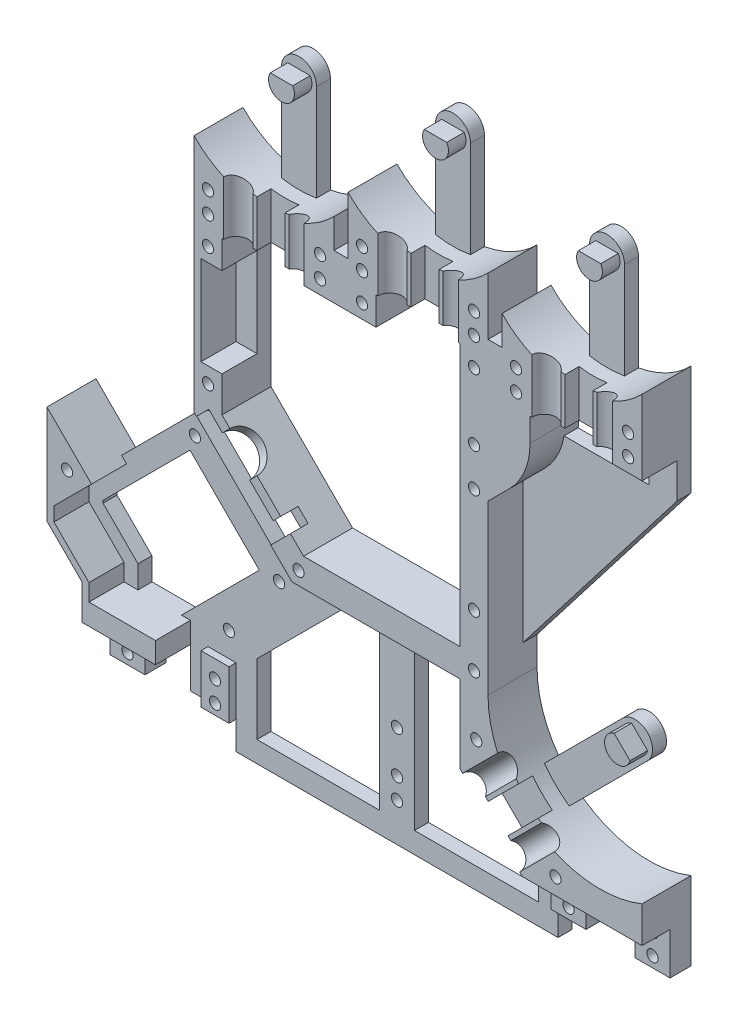
from build123d import *

# Parameters (mm, degrees)
SKETCH1_W                    = 12
SKETCH1_H                    = 5
BOSS_EXTRUDE1_DEPTH          = 2
BOSS_EXTRUDE2_DEPTH          = 7
BOSS_EXTRUDE3_DEPTH          = 2
BOSS_EXTRUDE4_START          = 2
BOSS_EXTRUDE4_DEPTH          = 2.5
WIRE_START                   = 67.5
WIRE_AND_TUBE_CANALS_DEPTH   = 13
CUT_EXTRUDE3_START           = 3
SKETCH42_W                   = 5
SKETCH42_H                   = 6
SKETCH42_W_2                 = 6.5
SKETCH42_H_2                 = 7
SKETCH42_W_3                 = 6
SKETCH42_H_3                 = 6.000000003
CUT_EXTRUDE3_DEPTH           = 4
FILLET1_R                    = 10
POT_INSERT1_DEPTH            = 2.5
POT_START                    = -2.5
SKETCH36_R                   = 2.75
POT_HOLE_DEPTH               = 1.5
POT_INSERT2_DEPTH            = 2.5
SKETCH3_R                    = 0.800000001
SKETCH3_R_2                  = 0.8
MECHANICAL_SCREW_HOLES_DEPTH = 128.295915171
SKETCH44_R                   = 0.8
ELECTRICAL_SCREW_HOLES_DEPTH = 128.295915171
CUT_EXTRUDE4_DEPTH           = 10


with BuildPart() as part:
    # Sketch1 → Boss-Extrude1 (new body)
    with BuildSketch(Plane.XY):
        with BuildLine():
            Line((68, 10.000000001), (85, 10.000000001))
            Line((85, 10.000000001), (85, 15.167603024))
            ThreePointArc((85, 15.167603024), (70.05572809, 16.73350084), (63, 30.000000001))
            Line((63, 30.000000001), (63, 34.000000004))
            Line((63, 34.000000004), (85, 62.500000004))
            Line((85, 62.500000004), (85, 71.500000004))
            Line((85, 71.500000004), (63, 71.500000004))
            Line((63, 71.500000004), (63, 75.500000004))
            Line((63, 75.500000004), (43, 75.500000004))
            Line((43, 75.500000004), (43, 71.500000004))
            Line((43, 71.500000004), (21, 71.500000004))
            Line((21, 71.500000004), (21, 43.999896972))
            Line((21, 43.999896972), (33.106562233, 31.893334739))
            Line((33.106562233, 31.893334739), (28.156814765, 26.943587271))
            Line((28.156814765, 26.943587271), (16.135999485, 38.964402551))
            Line((16.135999485, 38.964402551), (5.656854249, 28.485257316))
            Line((5.656854249, 28.485257316), (0, 34.142111565))
            Line((0, 34.142111565), (0, 20))
            Line((0, 20), (5, 15))
            Line((5, 15), (5, 10))
            Line((5, 10), (22, 10))
            Line((22, 10), (22, 0))
            Line((22, 0), (68, 0))
            Line((68, 0), (68, 10))
        make_face()
        Polygon((42.5, 3), (25, 3), (25, 13), (42.000000003, 30.000000003), (42.5, 30.000000003), align=None, mode=Mode.SUBTRACT)
        Polygon((3, 21.585762379), (15.428892704, 34.014655083), (25.328490668, 24.115057118), (14.21343355, 13), (8, 13), (8, 16.242640687), (3, 21.242640687), align=None, mode=Mode.SUBTRACT)
        Polygon((59.000000001, 18.887301629), (65.211417768, 12.675883862), (65.211417768, 2.999999998), (47.500000002, 2.999999998), (47.500000002, 30.000000001), (59.000000001, 30.000000001), align=None, mode=Mode.SUBTRACT)
        Polygon((25.000000003, 67.500000001), (47.000000003, 67.500000001), (47.000000003, 71.500000004), (59.000000003, 71.500000004), (59.000000003, 34.000000004), (36.656751217, 34.000000004), (25.000000003, 45.656751219), align=None, mode=Mode.SUBTRACT)
        with Locations((75, 65.000000004)):
            Rectangle(SKETCH1_W, SKETCH1_H, mode=Mode.SUBTRACT)
    extrude(amount=BOSS_EXTRUDE1_DEPTH)

    # Sketch5 → Boss-Extrude2 (add)
    # profile 1 of 2: a face of its own
    with BuildSketch(Plane.XY):
        with BuildLine():
            ThreePointArc((41, 78.202041029), (31, 74), (21, 78.202041029))
            Line((21, 78.202041029), (21, 43.999896972))
            Line((21, 43.999896972), (34.999896969, 30.000000003))
            Line((34.999896969, 30.000000003), (59.000000001, 30.000000003))
            Line((59.000000001, 30.000000003), (59.000000001, 18.887301629))
            Line((59.000000001, 18.887301629), (68, 9.887301629))
            Line((68, 9.887301629), (68, 4.000000002))
            Line((68, 4.000000002), (73, 4.000000002))
            Line((73, 4.000000002), (73, 10.000000002))
            Line((73, 10.000000002), (80, 10.000000002))
            Line((80, 10.000000002), (80, 4.000000002))
            Line((80, 4.000000002), (85, 4.000000002))
            Line((85, 4.000000002), (85, 15.167603027))
            ThreePointArc((85, 15.167603027), (70.05572809, 16.733500843), (63, 30.000000005))
            Line((63, 30.000000005), (63, 54.000000002))
            Line((63, 54.000000002), (69, 60.000000002))
            Line((69, 60.000000002), (69, 67.500000005))
            Line((69, 67.500000005), (85, 67.500000005))
            Line((85, 67.500000005), (85, 78.202041029))
            ThreePointArc((85, 78.202041029), (75, 74), (65, 78.202041029))
            Line((65, 78.202041029), (65, 74))
            Line((65, 74), (63, 74))
            Line((63, 74), (63, 82.202041032))
            ThreePointArc((63, 82.202041032), (53, 78.000000003), (43, 82.202041032))
            Line((43, 82.202041032), (43, 74))
            Line((43, 74), (41, 74))
            Line((41, 74), (41, 78.202041029))
        make_face()
        Polygon((22, 50.732233048), (22, 63.500000001), (25, 63.500000001), (25, 67.500000001), (47, 67.500000001), (47, 71.500000001), (59, 71.500000001), (59, 34.000000004), (36.656751217, 34.000000004), (25.000000003, 45.656751219), (25.000000003, 50.732233048), align=None, mode=Mode.SUBTRACT)
    # profile 2 of 2: a face of its own
    with BuildSketch(Plane.XY):
        Polygon((22, 11), (15.5, 11), (15.5, 13), (6, 13), (6, 15.414213562), (1, 20.414213562), (1, 22.414292532), (6.363961031, 27.778253562), (0, 34.142214593), (0, 20), (5, 15), (5, 4), (10, 4), (10, 10), (15.5, 10), (15.5, 4), (22, 4), align=None)
    extrude(amount=BOSS_EXTRUDE2_DEPTH)

    # Sketch33 → Boss-Extrude3 (add)
    with BuildSketch(Plane.XY):
        with BuildLine():
            Line((31, 67.500000001), (33.5, 67.500000001))
            Line((33.5, 67.500000001), (33.5, 88.000000001))
            ThreePointArc((33.5, 88.000000001), (31, 90.500000001), (28.5, 88.000000001))
            Line((28.5, 88.000000001), (28.5, 67.500000001))
            Line((28.5, 67.500000001), (31, 67.500000001))
        make_face()
        with BuildLine():
            Line((75, 67.500000004), (77.5, 67.500000004))
            Line((77.5, 67.500000004), (77.5, 88.000000004))
            ThreePointArc((77.5, 88.000000004), (75, 90.500000004), (72.5, 88.000000004))
            Line((72.5, 88.000000004), (72.5, 67.500000004))
            Line((72.5, 67.500000004), (75, 67.500000004))
        make_face()
        with BuildLine():
            Line((77.23223305, 31.767766956), (61.675883862, 16.211417768))
            Line((61.675883862, 16.211417768), (65.211417768, 12.675883862))
            Line((65.211417768, 12.675883862), (80.767766956, 28.23223305))
            ThreePointArc((80.767766956, 28.23223305), (80.767766956, 31.767766956), (77.23223305, 31.767766956))
        make_face()
        with BuildLine():
            Line((53, 71.500000004), (55.5, 71.500000004))
            Line((55.5, 71.500000004), (55.5, 92.000000004))
            ThreePointArc((55.5, 92.000000004), (53, 94.500000004), (50.5, 92.000000004))
            Line((50.5, 92.000000004), (50.5, 71.500000004))
            Line((50.5, 71.500000004), (53, 71.500000004))
        make_face()
    extrude(amount=BOSS_EXTRUDE3_DEPTH)

    # Sketch34 → Boss-Extrude4 (add)
    with BuildSketch(Plane.XY.offset(BOSS_EXTRUDE4_START)):
        with BuildLine():
            Line((29.397853003, 88.925000001), (32.602146997, 88.925000001))
            ThreePointArc((32.602146997, 88.925000001), (31, 86.150000001), (29.397853003, 88.925000001))
        make_face()
        with BuildLine():
            Line((51.397853003, 92.925000004), (54.602146997, 92.925000004))
            ThreePointArc((54.602146997, 92.925000004), (53, 90.150000004), (51.397853003, 92.925000004))
        make_face()
        with BuildLine():
            Line((73.397853003, 88.925000004), (76.602146997, 88.925000004))
            ThreePointArc((76.602146997, 88.925000004), (75, 86.150000004), (73.397853003, 88.925000004))
        make_face()
        with BuildLine():
            Line((78.52118477, 31.786962782), (80.786962782, 29.52118477))
            ThreePointArc((80.786962782, 29.52118477), (77.691852458, 28.691852458), (78.52118477, 31.786962782))
        make_face()
    extrude(amount=BOSS_EXTRUDE4_DEPTH)

    # Sketch10 → Wire and Tube Canals (cut)
    with BuildSketch(Plane(origin=(0, 0, 0), x_dir=(1, 0, 0), z_dir=(0, 1, 0)).offset(WIRE_START)):
        with BuildLine():
            Line((50.75, -7), (49, -7))
            Line((49, -7), (49, -6))
            Line((49, -6), (50.436140662, -6))
            ThreePointArc((50.436140662, -6), (47.33030749, -7.524048587), (50.75, -7))
        make_face()
        with BuildLine():
            ThreePointArc((50.436140662, -6), (50.66969251, -6.475951413), (50.75, -7))
            Line((50.75, -7), (55.25, -7))
            ThreePointArc((55.25, -7), (55.33030749, -6.475951413), (55.563859338, -6))
            Line((55.563859338, -6), (55, -6))
            Line((55, -6), (55, -4))
            Line((55, -4), (51, -4))
            Line((51, -4), (51, -6))
            Line((51, -6), (50.436140662, -6))
        make_face()
        with BuildLine():
            Line((57, -7), (55.25, -7))
            ThreePointArc((55.25, -7), (58.66969251, -7.524048587), (55.563859338, -6))
            Line((55.563859338, -6), (57, -6))
            Line((57, -6), (57, -7))
        make_face()
        with BuildLine():
            ThreePointArc((28.436140662, -6), (25.33030749, -7.524048587), (28.75, -7))
            Line((28.75, -7), (33.25, -7))
            ThreePointArc((33.25, -7), (36.66969251, -7.524048587), (33.563859338, -6))
            Line((33.563859338, -6), (33, -6))
            Line((33, -6), (33, -4))
            Line((33, -4), (29, -4))
            Line((29, -4), (29, -6))
            Line((29, -6), (28.436140662, -6))
        make_face()
        with BuildLine():
            Line((72.75, -7), (71, -7))
            Line((71, -7), (71, -6))
            Line((71, -6), (72.436140662, -6))
            ThreePointArc((72.436140662, -6), (69.33030749, -7.524048587), (72.75, -7))
        make_face()
        with BuildLine():
            ThreePointArc((72.436140662, -6), (72.66969251, -6.475951413), (72.75, -7))
            Line((72.75, -7), (77.25, -7))
            ThreePointArc((77.25, -7), (77.33030749, -6.475951413), (77.563859338, -6))
            Line((77.563859338, -6), (77, -6))
            Line((77, -6), (77, -4))
            Line((77, -4), (73, -4))
            Line((73, -4), (73, -6))
            Line((73, -6), (72.436140662, -6))
        make_face()
        with BuildLine():
            Line((79, -7), (77.25, -7))
            ThreePointArc((77.25, -7), (80.66969251, -7.524048587), (77.563859338, -6))
            Line((77.563859338, -6), (79, -6))
            Line((79, -6), (79, -7))
        make_face()
    extrude(amount=WIRE_AND_TUBE_CANALS_DEPTH, mode=Mode.SUBTRACT)


with BuildPart() as wire_and_tube_canals_kept_piece:
    # of the separate pieces the step leaves, the one the design keeps (wire_and_tube_canals_pieces_kept)
    add(part.part.solids().sort_by_distance((59.000000001, 30.000000002, 0))[0])

    # Sketch42 → Cut-Extrude3 (cut)
    with BuildSketch(Plane.XY.offset(CUT_EXTRUDE3_START)):
        with Locations((7.5, 7)):
            Rectangle(SKETCH42_W, SKETCH42_H)
        with Locations((18.75, 7.5)):
            Rectangle(SKETCH42_W_2, SKETCH42_H_2)
        with Locations((70, 7)):
            Rectangle(SKETCH42_W_3, SKETCH42_H)
        with Locations((82.5, 7.000000002)):
            Rectangle(SKETCH42_W, SKETCH42_H_3)
    extrude(amount=CUT_EXTRUDE3_DEPTH, mode=Mode.SUBTRACT)

    # Fillet1
    fillet1_edges = [wire_and_tube_canals_kept_piece.edges().sort_by_distance(p)[0] for p in [
        (69, 60.000000002, 4.5),
    ]]
    fillet(fillet1_edges, radius=FILLET1_R)

    # Sketch35 → Pot Insert1 (cut)
    with BuildSketch(Plane(origin=(32.499948486, 32.499948486, 0), x_dir=(0, 0, 1), z_dir=(-0.7071067811865477, -0.7071067811865475, 0))):
        Polygon((5.5, 15.763383116), (2.5, 14.263383116), (1.5, 14.263383116), (1.5, 10.263383116), (1.5, 6.013383116), (2.5, 6.013383116), (2.5, 0.763383116), (7, 0.763383116), (11.5, 0.763383116), (11.5, 6.013383116), (12.5, 6.013383116), (12.5, 10.263383116), (12.5, 14.263383116), (11.5, 14.263383116), (8.5, 15.763383116), (7, 15.763383116), align=None)
    extrude(amount=-POT_INSERT1_DEPTH, mode=Mode.SUBTRACT)

    # Sketch36 → Pot Hole (cut)
    with BuildSketch(Plane(origin=(32.499948486, 32.499948486, 0), x_dir=(0, 0, 1), z_dir=(-0.7071067811865477, -0.7071067811865475, 0)).offset(POT_START)):
        with Locations((7, 10.263383116)):
            Circle(SKETCH36_R)
        Polygon((7, 0.763383116), (4.5, 0.763383116), (4.5, 2.763383116), (9.5, 2.763383116), (9.5, 0.763383116), align=None)
    extrude(amount=-POT_HOLE_DEPTH, mode=Mode.SUBTRACT)

    # Sketch43 → Pot Insert2 (cut)
    with BuildSketch(Plane.ZY.offset(-15.5)):
        Polygon((8, -5.5), (11, -4), (12, -4), (12, 0), (12, 5.25), (11, 5.25), (11, 11), (6.5, 11), (2, 11), (2, 4.25), (1, 4.25), (1, 0), (1, -4), (2, -4), (5, -5.5), (6.5, -5.5), align=None)
    extrude(amount=-POT_INSERT2_DEPTH, mode=Mode.SUBTRACT)

    # Sketch3 → Mechanical Screw Holes (cut, through all)
    with BuildSketch(Plane.XY):
        with Locations((67, 72.5)):
            Circle(SKETCH3_R)
        with Locations((83, 72.5)):
            Circle(SKETCH3_R)
        with Locations((61, 76.5)):
            Circle(SKETCH3_R)
        with Locations((45, 76.5)):
            Circle(SKETCH3_R)
        with Locations((23, 72.5)):
            Circle(SKETCH3_R_2)
        with Locations((39, 72.5)):
            Circle(SKETCH3_R_2)
        with Locations((83, 69.5)):
            Circle(SKETCH3_R)
        with Locations((67, 69.5)):
            Circle(SKETCH3_R)
        with Locations((61, 73.5)):
            Circle(SKETCH3_R)
        with Locations((45, 73.5)):
            Circle(SKETCH3_R)
        with Locations((23, 69.5)):
            Circle(SKETCH3_R_2)
        with Locations((39, 69.5)):
            Circle(SKETCH3_R_2)
        with Locations((35.934989358, 31.893334739)):
            Circle(SKETCH3_R_2)
        with Locations((61.322330472, 23.636038972)):
            Circle(SKETCH3_R_2)
        with Locations((23, 65.5)):
            Circle(SKETCH3_R_2)
        with Locations((45, 69.5)):
            Circle(SKETCH3_R_2)
        with Locations((61, 69.5)):
            Circle(SKETCH3_R_2)
        with Locations((72.636038971, 12.322330473)):
            Circle(SKETCH3_R_2)
        with Locations((61, 54.5)):
            Circle(SKETCH3_R_2)
        with Locations((16.135999485, 36.136078454)):
            Circle(SKETCH3_R_2)
        with Locations((28.156814765, 24.115263174)):
            Circle(SKETCH3_R_2)
        with Locations((23, 48.5)):
            Circle(SKETCH3_R_2)
        with Locations((61, 39.5)):
            Circle(SKETCH3_R_2)
        with Locations((45, 8.5)):
            Circle(SKETCH3_R_2)
        with Locations((82.5, 5.5)):
            Circle(SKETCH3_R_2)
        with Locations((82.5, 8.5)):
            Circle(SKETCH3_R_2)
        with Locations((70.5, 5.5)):
            Circle(SKETCH3_R_2)
        with Locations((70.5, 8.5)):
            Circle(SKETCH3_R_2)
        with Locations((7.5, 5.5)):
            Circle(SKETCH3_R_2)
        with Locations((7.5, 8.5)):
            Circle(SKETCH3_R_2)
        with Locations((20, 5.5)):
            Circle(SKETCH3_R_2)
        with Locations((20, 8.5)):
            Circle(SKETCH3_R_2)
        with Locations((61, 32)):
            Circle(SKETCH3_R_2)
        with Locations((45, 5.5)):
            Circle(SKETCH3_R_2)
        with Locations((2.863961031, 27.778253562)):
            Circle(SKETCH3_R_2)
    extrude(amount=MECHANICAL_SCREW_HOLES_DEPTH, mode=Mode.SUBTRACT)

    # Sketch44 → Electrical Screw Holes (cut, through all)
    with BuildSketch(Plane.XY):
        with Locations((61, 60)):
            Circle(SKETCH44_R)
        with Locations((21, 14.500000001)):
            Circle(SKETCH44_R)
        with Locations((45, 14.500000001)):
            Circle(SKETCH44_R)
    extrude(amount=ELECTRICAL_SCREW_HOLES_DEPTH, mode=Mode.SUBTRACT)

    # Sketch45 → Cut-Extrude4 (cut)
    with BuildSketch(Plane(origin=(38.943650815, 38.943650815, 0), x_dir=(0, 0, 1), z_dir=(-0.7071067811865477, -0.7071067811865474, 0))):
        with BuildLine():
            ThreePointArc((7, -28.898232279), (5.33030749, -30.124183692), (6, -32.08437294))
            Line((6, -32.08437294), (6, -32.648232279))
            Line((6, -32.648232279), (4, -32.648232279))
            Line((4, -32.648232279), (4, -36.648232279))
            Line((4, -36.648232279), (6, -36.648232279))
            Line((6, -36.648232279), (6, -37.212091617))
            ThreePointArc((6, -37.212091617), (5.33030749, -39.172280865), (7, -40.398232279))
            Line((7, -40.398232279), (7, -28.898232279))
        make_face()
    extrude(amount=-CUT_EXTRUDE4_DEPTH, mode=Mode.SUBTRACT)


solid = wire_and_tube_canals_kept_piece.part
